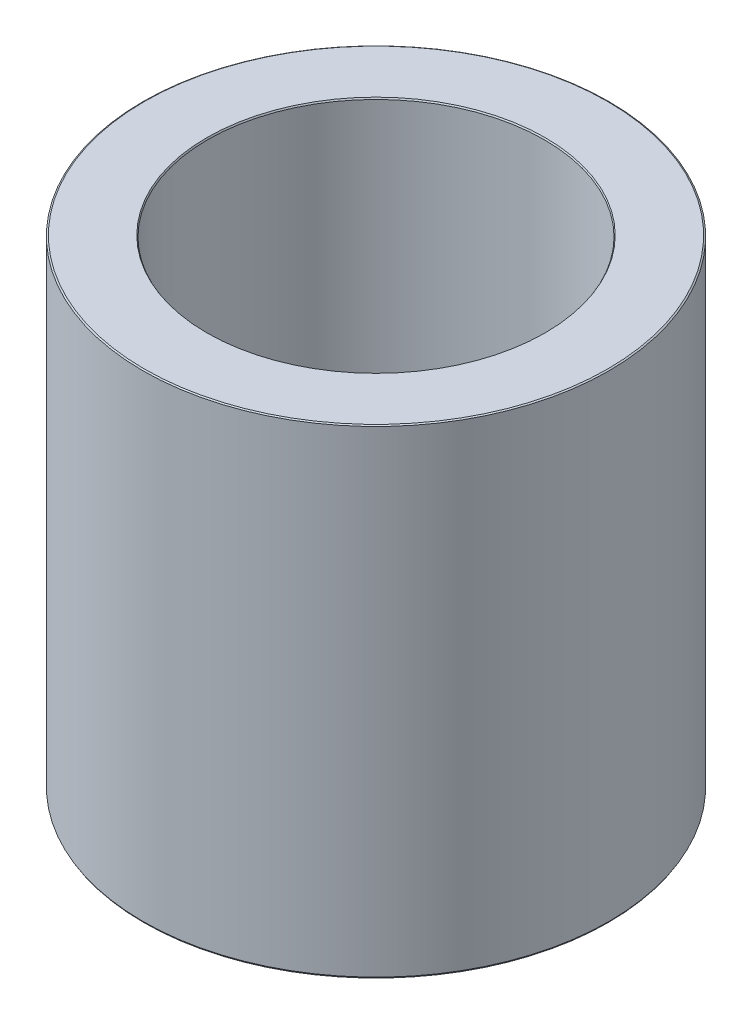
from build123d import *
from OCP.BRepFilletAPI import BRepFilletAPI_MakeChamfer

# Parameters (mm, degrees)
SKETCH1_R           = 60
BOSS_EXTRUDE1_DEPTH = 123.33622773
SKETCH2_R           = 43.331278952
CUT_EXTRUDE1_DEPTH  = 150.705795047
CHAMFER1_SIZE       = 0.211502182
CHAMFER1_SIZE2      = 0.366332526


with BuildPart() as part:
    # Sketch1 → Boss-Extrude1 (new body)
    with BuildSketch(Plane(origin=(0, 0, 0), x_dir=(1, 0, 0), z_dir=(0, 1, 0))):
        Circle(SKETCH1_R)
    extrude(amount=BOSS_EXTRUDE1_DEPTH)

    # Sketch2 → Cut-Extrude1 (cut, through all)
    with BuildSketch(Plane(origin=(0, 0, 0), x_dir=(1, 0, 0), z_dir=(0, 1, 0))):
        Circle(SKETCH2_R)
    extrude(amount=CUT_EXTRUDE1_DEPTH, mode=Mode.SUBTRACT)

    # Chamfer1: one chamfer whose edges measure the first distance from different faces: ONE call of the kernel's chamfer builder (chamfer() names one face for all edges)
    chamfer1_edges_1 = [part.edges().sort_by_distance(p)[0] for p in [
        (-43.331278952, 123.33622773, 0),
    ]]
    chamfer1_side_1 = [part.faces().sort_by_distance(p)[0] for p in [
        (-58.302943725, 123.33622773, 0),
    ]]
    chamfer1_edges_2 = [part.edges().sort_by_distance(p)[0] for p in [
        (-43.331278952, 0, 0),
    ]]
    chamfer1_side_2 = [part.faces().sort_by_distance(p)[0] for p in [
        (-43.331278952, 61.668113865, 0),
    ]]
    chamfer1_edges_3 = [part.edges().sort_by_distance(p)[0] for p in [
        (-60, 0, 0),
    ]]
    chamfer1_side_3 = [part.faces().sort_by_distance(p)[0] for p in [
        (-58.302943725, 0, 0),
    ]]
    chamfer1_edges_4 = [part.edges().sort_by_distance(p)[0] for p in [
        (-60, 123.33622773, 0),
    ]]
    chamfer1_side_4 = [part.faces().sort_by_distance(p)[0] for p in [
        (-60, 61.668113865, 0),
    ]]
    chamfer1 = BRepFilletAPI_MakeChamfer(part.part.solid().wrapped)
    for e in chamfer1_edges_1:
        chamfer1.Add(CHAMFER1_SIZE, CHAMFER1_SIZE2, e.wrapped, chamfer1_side_1[0].wrapped)  # the first distance lies on this face
    for e in chamfer1_edges_2:
        chamfer1.Add(CHAMFER1_SIZE, CHAMFER1_SIZE2, e.wrapped, chamfer1_side_2[0].wrapped)  # the first distance lies on this face
    for e in chamfer1_edges_3:
        chamfer1.Add(CHAMFER1_SIZE, CHAMFER1_SIZE2, e.wrapped, chamfer1_side_3[0].wrapped)  # the first distance lies on this face
    for e in chamfer1_edges_4:
        chamfer1.Add(CHAMFER1_SIZE, CHAMFER1_SIZE2, e.wrapped, chamfer1_side_4[0].wrapped)  # the first distance lies on this face
    add(Compound.cast(chamfer1.Shape()), mode=Mode.REPLACE)


solid = part.part
